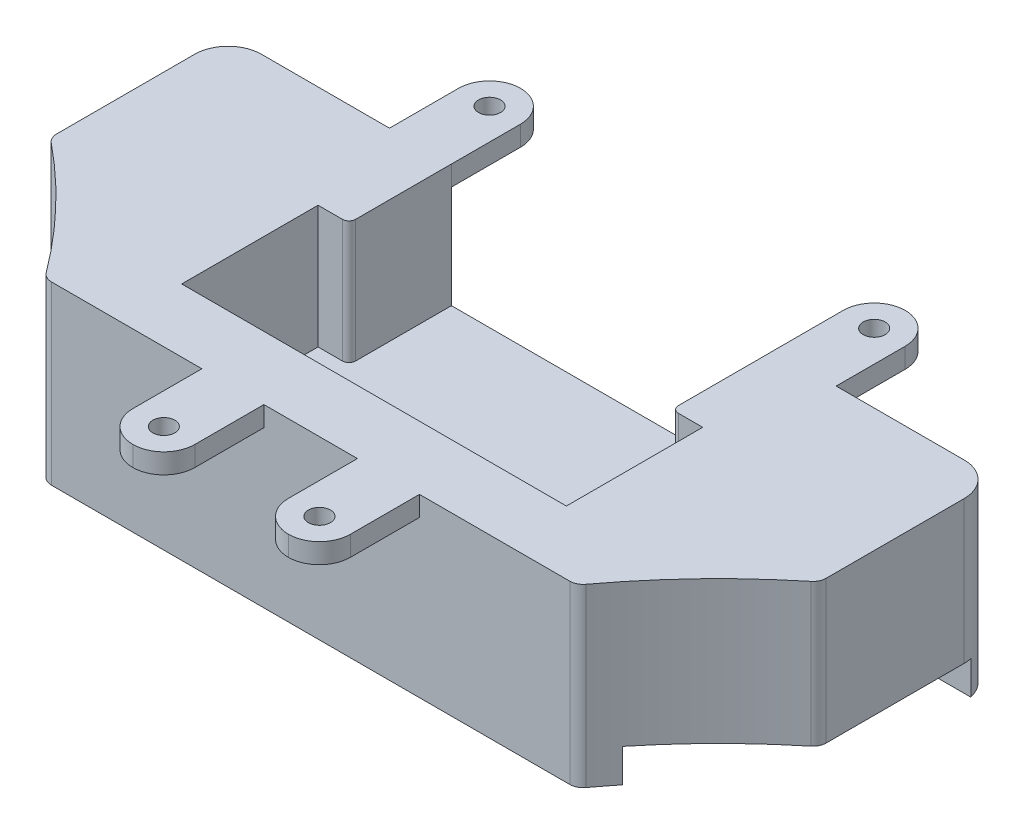
from build123d import *

# Parameters (mm, degrees)
CROQUIS2_W              = 115.37
CROQUIS2_H              = 45.3
CROQUIS2_R              = 3.25
CROQUIS2_R_2            = 1.65
SALIENTE_EXTRUIR1_DEPTH = 21.4
CROQUIS6_W              = 48.38
CROQUIS6_H              = 35.8
CORTAR_EXTRUIR1_DEPTH   = 18.4
CROQUIS9_W              = 9.3
CROQUIS9_H              = 15
CROQUIS9_R              = 1.65
SALIENTE_EXTRUIR4_DEPTH = 3
REDONDEO8_R             = 4.65
CROQUIS7_W              = 115.37
CROQUIS7_H              = 3.9
SALIENTE_EXTRUIR3_DEPTH = 5
REDONDEO2_R             = 5
CORTAR_EXTRUIR2_DEPTH   = 133.828035068
REDONDEO9_R             = 2
CROQUIS12_W             = 57.67
CROQUIS12_H             = 20.44
CORTAR_EXTRUIR3_DEPTH   = 18.4
REDONDEO10_R            = 1


with BuildPart() as part:
    # Croquis2 → Saliente-Extruir1 (new body)
    with BuildSketch(Plane(origin=(0, 0, 0), x_dir=(1, 0, 0), z_dir=(0, 1, 0))):
        with Locations((57.685, 22.65)):
            Rectangle(CROQUIS2_W, CROQUIS2_H)
        with Locations(Location((57.685, 19.5, 0), (0, 0, 270))):
            Circle(CROQUIS2_R, mode=Mode.SUBTRACT)
        with Locations(Location((75.685, 19.5, 0), (0, 0, 270))):
            Circle(CROQUIS2_R_2, mode=Mode.SUBTRACT)
        with Locations(Location((39.685, 19.5, 0), (0, 0, 90))):
            Circle(CROQUIS2_R_2, mode=Mode.SUBTRACT)
    extrude(amount=SALIENTE_EXTRUIR1_DEPTH)

    # Croquis6 → Cortar-Extruir1 (cut)
    with BuildSketch(Plane(origin=(0, 21.4, 0), x_dir=(1, 0, 0), z_dir=(0, 1, 0))):
        with Locations((57.685, 27.4)):
            Rectangle(CROQUIS6_W, CROQUIS6_H)
    extrude(amount=-CORTAR_EXTRUIR1_DEPTH, mode=Mode.SUBTRACT)

    # Croquis9 → Saliente-Extruir4 (add)
    # profile 1 of 4: a face of its own
    with BuildSketch(Plane(origin=(0, 21.4, 0), x_dir=(1, 0, 0), z_dir=(0, 1, 0))):
        with Locations((86.52, 52.8)):
            Rectangle(CROQUIS9_W, CROQUIS9_H)
        with Locations(Location((86.52, 55.65, 0), (0, 0, 270))):
            Circle(CROQUIS9_R, mode=Mode.SUBTRACT)
    # profile 2 of 4: a face of its own
    with BuildSketch(Plane(origin=(0, 21.4, 0), x_dir=(1, 0, 0), z_dir=(0, 1, 0))):
        with Locations((28.85, 52.8)):
            Rectangle(CROQUIS9_W, CROQUIS9_H)
        with Locations(Location((28.85, 55.65, 0), (0, 0, 90))):
            Circle(CROQUIS9_R, mode=Mode.SUBTRACT)
    # profile 3 of 4: a face of its own
    with BuildSketch(Plane(origin=(0, 21.4, 0), x_dir=(1, 0, 0), z_dir=(0, 1, 0))):
        with Locations((69.345, -7.5)):
            Rectangle(CROQUIS9_W, CROQUIS9_H)
        with Locations(Location((69.345, -10.35, 0), (0, 0, 270))):
            Circle(CROQUIS9_R, mode=Mode.SUBTRACT)
    # profile 4 of 4: a face of its own
    with BuildSketch(Plane(origin=(0, 21.4, 0), x_dir=(1, 0, 0), z_dir=(0, 1, 0))):
        with Locations((46.025, -7.5)):
            Rectangle(CROQUIS9_W, CROQUIS9_H)
        with Locations(Location((46.025, -10.35, 0), (0, 0, 90))):
            Circle(CROQUIS9_R, mode=Mode.SUBTRACT)
    extrude(amount=-SALIENTE_EXTRUIR4_DEPTH)

    # Redondeo8
    redondeo8_edges = [part.edges().sort_by_distance(p)[0] for p in [
        (73.995, 19.9, 15),
        (64.695, 19.9, 15),
        (41.375, 19.9, 15),
        (50.675, 19.9, 15),
        (91.17, 19.9, -60.3),
        (81.87, 19.9, -60.3),
        (33.5, 19.9, -60.3),
        (24.2, 19.9, -60.3),
    ]]
    fillet(redondeo8_edges, radius=REDONDEO8_R - 0.0001)  # a hair under: the kernel refuses the full size

    # Croquis7 → Saliente-Extruir3 (add)
    with BuildSketch(Plane.XZ):
        with Locations((57.685, -43.35)):
            Rectangle(CROQUIS7_W, CROQUIS7_H)
        with Locations((57.685, -1.95)):
            Rectangle(CROQUIS7_W, CROQUIS7_H)
    extrude(amount=SALIENTE_EXTRUIR3_DEPTH)

    # Redondeo2
    redondeo2_edges = [part.edges().sort_by_distance(p)[0] for p in [
        (0, 8.2, 0),
        (0, 8.2, -45.3),
        (115.37, 8.2, -45.3),
        (115.37, 8.2, 0),
    ]]
    fillet(redondeo2_edges, radius=REDONDEO2_R)

    # Croquis11 → Cortar-Extruir2 (cut, through all)
    with BuildSketch(Plane(origin=(0, 21.4, 0), x_dir=(1, 0, 0), z_dir=(0, 1, 0))):
        with BuildLine():
            Line((115.37, 18.647739407), (115.37, 5))
            ThreePointArc((115.37, 5), (113.905533906, 1.464466094), (110.37, 0))
            Line((110.37, 0), (97.550134045, 0))
            ThreePointArc((97.550134045, 0), (105.831202258, 9.924815779), (115.37, 18.647739407))
        make_face()
        with BuildLine():
            Line((0, 18.647739407), (0, 5))
            ThreePointArc((0, 5), (1.464466094, 1.464466094), (5, 0))
            Line((5, 0), (17.819865955, 0))
            ThreePointArc((17.819865955, 0), (9.538797742, 9.924815779), (0, 18.647739407))
        make_face()
    extrude(amount=-CORTAR_EXTRUIR2_DEPTH, mode=Mode.SUBTRACT)

    # Redondeo9
    redondeo9_edges = [part.edges().sort_by_distance(p)[0] for p in [
        (97.550134045, 8.2, 0),
        (115.37, 10.7, -18.647739407),
        (0, 10.7, -18.647739407),
        (17.819865955, 8.2, 0),
    ]]
    fillet(redondeo9_edges, radius=REDONDEO9_R)

    # Croquis12 → Cortar-Extruir3 (cut)
    with BuildSketch(Plane(origin=(0, 21.4, 0), x_dir=(1, 0, 0), z_dir=(0, 1, 0))):
        with Locations((57.685, 19.72)):
            Rectangle(CROQUIS12_W, CROQUIS12_H)
    extrude(amount=-CORTAR_EXTRUIR3_DEPTH, mode=Mode.SUBTRACT)

    # Redondeo10
    redondeo10_edges = [part.edges().sort_by_distance(p)[0] for p in [
        (33.495, 12.2, -29.94),
        (81.875, 12.2, -29.94),
    ]]
    fillet(redondeo10_edges, radius=REDONDEO10_R)


solid = part.part
